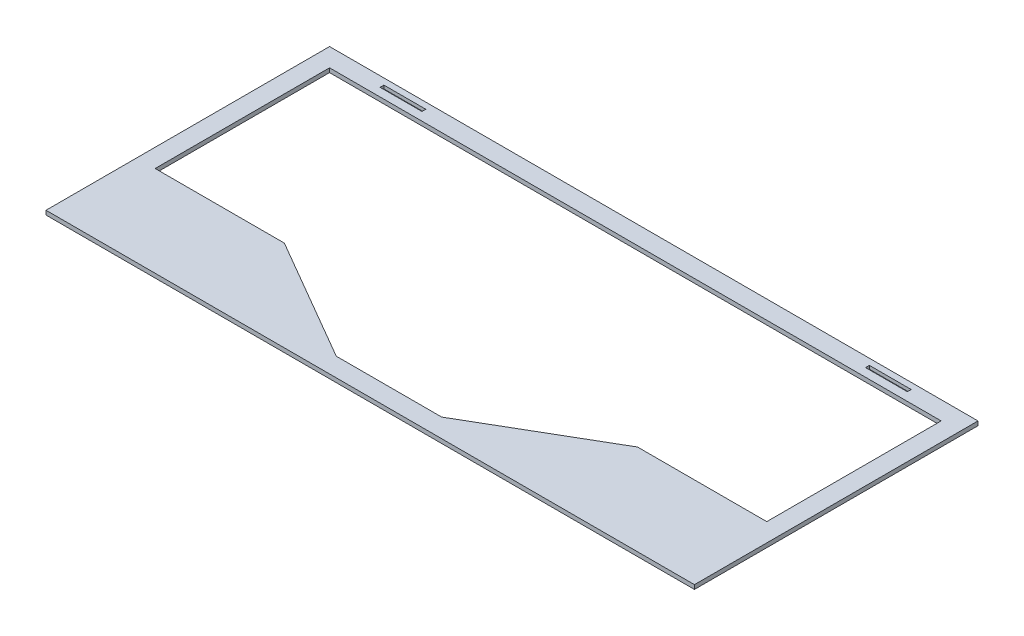
from build123d import *

# Parameters (mm, degrees)
SKETCH1_W           = 387.4
SKETCH1_H           = 169.4
BOSS_EXTRUDE1_DEPTH = 2.5
SKETCH3_W           = 25
SKETCH3_H           = 2.3
CUT_EXTRUDE2_DEPTH  = 2
CUT_EXTRUDE3_DEPTH  = 10


with BuildPart() as part:
    # Sketch1 → Boss-Extrude1 (new body)
    with BuildSketch(Plane(origin=(0, 0, 0), x_dir=(1, 0, 0), z_dir=(0, 1, 0))):
        Rectangle(SKETCH1_W, SKETCH1_H)
    extrude(amount=BOSS_EXTRUDE1_DEPTH)

    # Sketch3 → Cut-Extrude2 (cut)
    with BuildSketch(Plane(origin=(0, 2.5, 0), x_dir=(1, 0, 0), z_dir=(0, 1, 0))):
        with Locations((145, 79.85)):
            Rectangle(SKETCH3_W, SKETCH3_H)
        with Locations((-145, 79.85)):
            Rectangle(SKETCH3_W, SKETCH3_H)
    extrude(amount=-CUT_EXTRUDE2_DEPTH, mode=Mode.SUBTRACT)

    # Sketch4 → Cut-Extrude3 (cut)
    with BuildSketch(Plane.XZ):
        Polygon((31.499996994, 73.5), (105.5, 30.5), (182.7, 30.5), (182.7, -73.7), (-182.7, -73.7), (-182.7, 30.5), (-105.5, 30.5), (-31.499996994, 73.5), align=None)
    extrude(amount=-CUT_EXTRUDE3_DEPTH, mode=Mode.SUBTRACT)


solid = part.part
